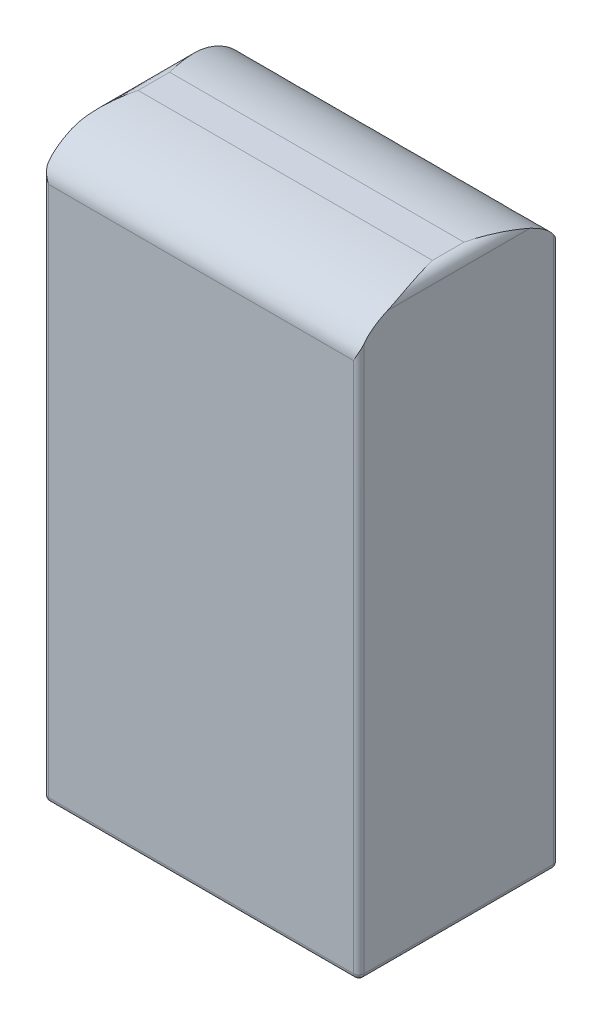
from build123d import *

# Parameters (mm, degrees)
SKETCH1_W           = 30
SKETCH1_H           = 55
BOSS_EXTRUDE1_DEPTH = 9.5
FILLET1_R           = 0.5
FILLET2_SIZE        = 4
FILLET2_SIZE_2      = 8
FILLET3_START       = -16
FILLET3_DEPTH       = 32
FILLET4_R           = 1


with BuildPart() as part:
    # Sketch1 → Boss-Extrude1 (new, symmetric)
    with BuildSketch(Plane.XY):
        with Locations((0, 27.5)):
            Rectangle(SKETCH1_W, SKETCH1_H)
    extrude(amount=BOSS_EXTRUDE1_DEPTH, both=True)

    # Fillet1
    fillet1_edges = [part.edges().sort_by_distance(p)[0] for p in [
        (-15, 27.5, 9.5),
        (0, 0, 9.5),
        (15, 27.5, 9.5),
        (0, 0, -9.5),
        (-15, 27.5, -9.5),
        (15, 27.5, -9.5),
        (15, 0, 0),
        (-15, 0, 0),
    ]]
    fillet(fillet1_edges, radius=FILLET1_R)

    # Fillet2
    # a fillet whose section is not a circle: 8, 4 mm, written as the material it takes off along each edge
    with BuildSketch(Plane(origin=(-34.5, 55, 9.5), x_dir=(0, -1, 0), z_dir=(1, 0, 0))) as fillet2_piece_1:
        with BuildLine():
            Bezier((FILLET2_SIZE, 0), (0, 0), (0, FILLET2_SIZE_2), weights=[1, 0.707106781, 1])
            Line((0, FILLET2_SIZE_2), (0, 0))
            Line((0, 0), (FILLET2_SIZE, 0))
        make_face()
    extrude(amount=69, mode=Mode.SUBTRACT)

    # Fillet3: read off the stored shape, not the designer's step
    # Fillet3 outline → Fillet3 (cut)
    with BuildSketch(Plane.YZ.offset(FILLET3_START)):
        with BuildLine():
            Line((55, -9.5), (55, -1.5))
            add(Edge.make_bspline(
                [(55, -1.5), (55, -9.5), (51, -9.5)],
                knots=[0, 0, 0, 1, 1, 1], degree=2, weights=[1, 0.707106781, 1]))
            Line((51, -9.5), (55, -9.5))
        make_face()
    extrude(amount=FILLET3_DEPTH, mode=Mode.SUBTRACT)

    # Fillet4
    # the kernel refuses this fillet: 1 mm, written as the material it takes off along each edge
    with BuildSketch(Plane(origin=(-15, 55, 9), x_dir=(0, -1, 0), z_dir=(0, 0, -1)), Plane(origin=(15, 55, -9), x_dir=(0, -1, 0), z_dir=(0, 0, 1))) as fillet4_piece_1:
        with BuildLine():
            CenterArc((FILLET4_R, -FILLET4_R), FILLET4_R, 90, 90)
            Line((0, -FILLET4_R), (0, 0))
            Line((0, 0), (FILLET4_R, 0))
        make_face()
    extrude(amount=18, mode=Mode.SUBTRACT)


solid = part.part
